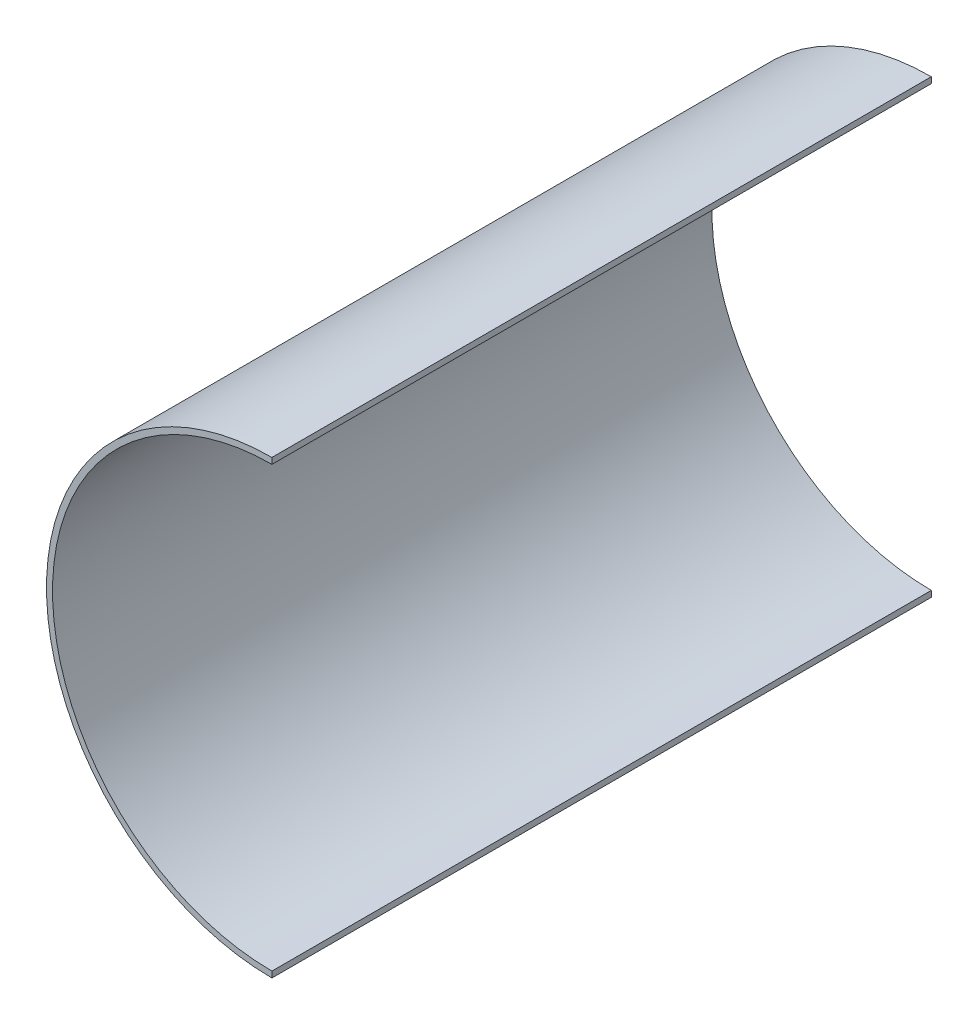
from build123d import *
from OCP.BRepAlgoAPI import BRepAlgoAPI_Cut
from OCP.TopTools import TopTools_ListOfShape

# Parameters (mm, degrees)
ESTRUSIONE_SOTTILE1_START = 16.551669
SCHIZZO1_R                = 75
SCHIZZO1_R_2              = 73
ESTRUSIONE_SOTTILE1_DEPTH = 219.384994
SCHIZZO5_W                = 100
SCHIZZO5_H                = 180
TAGLIO_ESTRUSIONE1_DEPTH  = 391


with BuildPart() as part:
    # Schizzo1 → Estrusione-Sottile1 (new body)
    with BuildSketch(Plane.XY.offset(ESTRUSIONE_SOTTILE1_START)):
        Circle(SCHIZZO1_R)
        Circle(SCHIZZO1_R_2, mode=Mode.SUBTRACT)
    extrude(amount=ESTRUSIONE_SOTTILE1_DEPTH)


with BuildPart() as taglio_estrusione1_tool:
    # Schizzo5 → Taglio-Estrusione1 (new body)
    with BuildSketch(Plane.XY.offset(235.936662498)):
        with Locations((50, 0)):
            Rectangle(SCHIZZO5_W, SCHIZZO5_H)
    extrude(amount=-TAGLIO_ESTRUSIONE1_DEPTH)


with BuildPart() as part_1:
    add(part.part)

    # Taglio-Estrusione1: cut by taglio_estrusione1_tool, with a tolerance
    taglio_estrusione1_stock = TopTools_ListOfShape()
    taglio_estrusione1_stock.Append(part_1.part.wrapped)
    taglio_estrusione1_tools = TopTools_ListOfShape()
    taglio_estrusione1_tools.Append(taglio_estrusione1_tool.part.wrapped)
    taglio_estrusione1_cut = BRepAlgoAPI_Cut()
    taglio_estrusione1_cut.SetArguments(taglio_estrusione1_stock)
    taglio_estrusione1_cut.SetTools(taglio_estrusione1_tools)
    taglio_estrusione1_cut.SetFuzzyValue(0.00001)
    taglio_estrusione1_cut.Build()
    add(Compound.cast(taglio_estrusione1_cut.Shape()).solids(), mode=Mode.REPLACE)


solid = part_1.part
